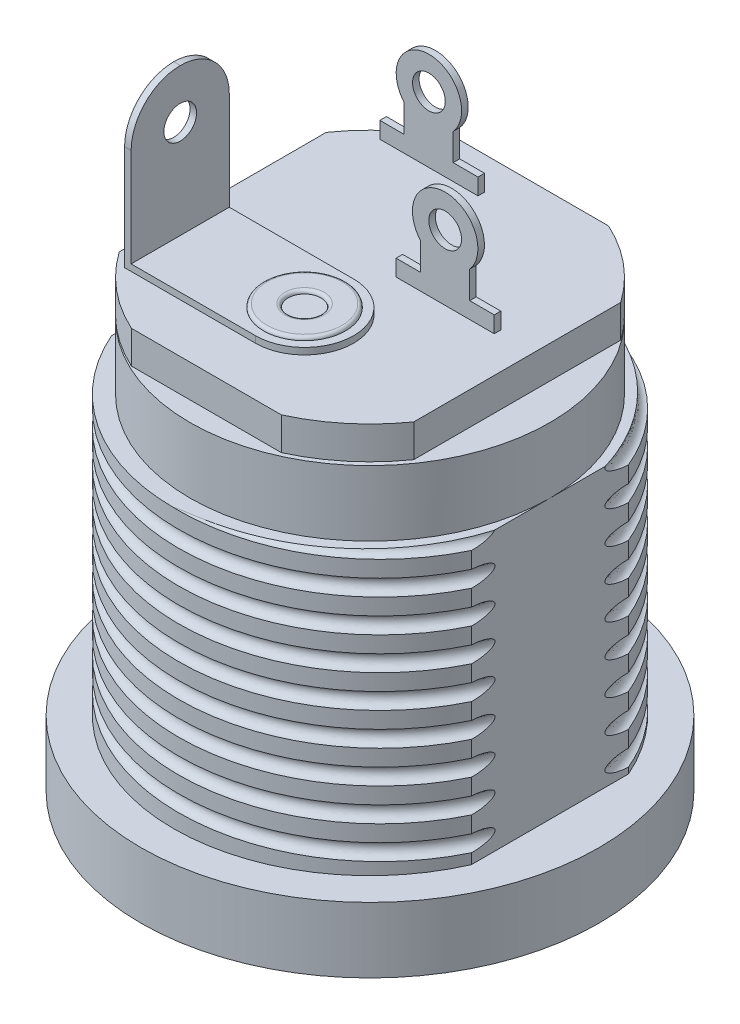
from build123d import *

# Parameters (mm, degrees)
SKETCH1_R            = 7
BOSS_EXTRUDE1_DEPTH  = 2
SKETCH3_R            = 6
BOSS_EXTRUDE2_DEPTH  = 10.5
SKETCH4_OUTSIDE_W    = 20.682
SKETCH4_OUTSIDE_H    = 20.682
SKETCH4_OUTSIDE_W_2  = 11
SKETCH4_OUTSIDE_H_2  = 19.10717674
CUT_EXTRUDE1_DEPTH   = 10.5
CUT_SWEEP1_PITCH     = 1
SKETCH7_OUTSIDE_W    = 20.682
SKETCH7_OUTSIDE_H    = 20.682
SKETCH7_OUTSIDE_R    = 5.5
CUT_EXTRUDE2_DEPTH   = 2
BOSS_EXTRUDE3_START  = 1.1
BOSS_EXTRUDE3_DEPTH  = 1
BOSS_EXTRUDE4_DEPTH  = 0.2
SKETCH12_W           = 0.2
SKETCH12_H           = 3
BOSS_EXTRUDE5_DEPTH  = 4.5
FILLET1_R            = 1.5
SKETCH13_R           = 0.5
CUT_EXTRUDE3_DEPTH   = 23.469757533
SKETCH14_W           = 3
SKETCH14_H           = 0.2
BOSS_EXTRUDE6_DEPTH  = 0.5
SKETCH16_R           = 0.5
BOSS_EXTRUDE7_DEPTH  = 0.2
SKETCH17_W           = 3
SKETCH17_H           = 0.2
BOSS_EXTRUDE8_DEPTH  = 0.5
SKETCH18_R           = 0.5
BOSS_EXTRUDE9_DEPTH  = 0.2
SKETCH21_R           = 3
CUT_EXTRUDE4_DEPTH   = 10
SKETCH22_R           = 1
BOSS_EXTRUDE10_DEPTH = 8
FILLET2_R            = 1
BOSS_EXTRUDE11_DEPTH = 0.1
SKETCH24_R           = 1.25
SKETCH24_R_2         = 0.5
EXTRUDE_THIN1_DEPTH  = 0.1
FILLET3_R            = 0.1


with BuildPart() as part:
    # Sketch1 → Boss-Extrude1 (new body)
    with BuildSketch(Plane(origin=(0, 0, 0), x_dir=(1, 0, 0), z_dir=(0, 1, 0))):
        with Locations(Location((0, 0, 0), (0, 0, 270))):
            Circle(SKETCH1_R)
    extrude(amount=BOSS_EXTRUDE1_DEPTH)

    # Sketch3 → Boss-Extrude2 (add)
    with BuildSketch(Plane(origin=(0, 2, 0), x_dir=(1, 0, 0), z_dir=(0, 1, 0))):
        with Locations(Location((0, 0, 0), (0, 0, 90))):
            Circle(SKETCH3_R)
    extrude(amount=BOSS_EXTRUDE2_DEPTH)

    # Sketch4 outside → Cut-Extrude1 (cut)
    with BuildSketch(Plane(origin=(0, 12.5, 0), x_dir=(1, 0, 0), z_dir=(0, 1, 0))):
        Rectangle(SKETCH4_OUTSIDE_W, SKETCH4_OUTSIDE_H)
        Rectangle(SKETCH4_OUTSIDE_W_2, SKETCH4_OUTSIDE_H_2, mode=Mode.SUBTRACT)
    extrude(amount=-CUT_EXTRUDE1_DEPTH, mode=Mode.SUBTRACT)

    # Cut-Sweep1: arcs per turn and ends read off the stored shape
    # Cut-Sweep1: the profile of Sketch6 screwed along a left-hand helix through 9 turns, 8 arcs to a turn; built about Z, then put on its axis
    cut_sweep1_z = Axis((0, 0, 0), (0, 0, 1))
    cut_sweep1_corners = [(5.75, 0, 0), (6, 0, 0.25), (6.25, 0, 0), (6, 0, -0.25)]
    with BuildLine(mode=Mode.PRIVATE) as cut_sweep1_profile:
        ThreePointArc((5.75, 0, 0), (5.823223305, 0, 0.176776695), (6, 0, 0.25))
        ThreePointArc((6, 0, 0.25), (6.176776695, 0, 0.176776695), (6.25, 0, 0))
        ThreePointArc((6.25, 0, 0), (6.176776695, 0, -0.176776695), (6, 0, -0.25))
        ThreePointArc((6, 0, -0.25), (5.823223305, 0, -0.176776695), (5.75, 0, 0))
    cut_sweep1_cap = Face(cut_sweep1_profile.wire())
    cut_sweep1_arcs = [((5.75, 0, 0), (5.75, 0, 0.25), (6, 0, 0.25), (1, 0.7071067811865476, 1)), ((6, 0, 0.25), (6.25, 0, 0.25), (6.25, 0, 0), (1, 0.7071067811865476, 1)), ((6.25, 0, 0), (6.25, 0, -0.25), (6, 0, -0.25), (1, 0.7071067811865476, 1)), ((6, 0, -0.25), (5.75, 0, -0.25), (5.75, 0, 0), (1, 0.7071067811865476, 1))]  # start, shoulder, end, weights
    cut_sweep1_turn_angles = [0, -22.5, -45, -67.5, -90, -112.5, -135, -157.5, -180, -202.5, -225, -247.5, -270, -292.5, -315, -337.5, -360]
    cut_sweep1_turn_weights = [1, 0.9238795325112867, 1, 0.9238795325112867, 1, 0.9238795325112867, 1, 0.9238795325112867, 1, 0.9238795325112867, 1, 0.9238795325112867, 1, 0.9238795325112867, 1, 0.9238795325112867, 1]
    cut_sweep1_turn_sides = [Face.make_bezier_surface([[Vector(p[j][0], p[j][1], 0).rotate(cut_sweep1_z, cut_sweep1_turn_angles[2 * i + k]) / cut_sweep1_turn_weights[2 * i + k] + Vector(0, 0, p[j][2] + -CUT_SWEEP1_PITCH * cut_sweep1_turn_angles[2 * i + k] / 360) for k in range(3)] for j in range(3)], [[p[3][j] * cut_sweep1_turn_weights[2 * i + k] for k in range(3)] for j in range(3)]) for p in cut_sweep1_arcs for i in range(8)]
    cut_sweep1 = Plane(origin=(0, 2, 0), x_dir=(-1, 0, 0), z_dir=(0, 1, 0)) * Solid(Shell([*[p.moved(Location((0, 0, CUT_SWEEP1_PITCH * i))) for i in range(9) for p in cut_sweep1_turn_sides], cut_sweep1_cap, cut_sweep1_cap.rotate(cut_sweep1_z, -3240).moved(Location((0, 0, -CUT_SWEEP1_PITCH * -3240 / 360)))]))
    add(cut_sweep1, mode=Mode.SUBTRACT)

    # Sketch7 outside → Cut-Extrude2 (cut)
    with BuildSketch(Plane(origin=(0, 12.5, 0), x_dir=(1, 0, 0), z_dir=(0, 1, 0))):
        Rectangle(SKETCH7_OUTSIDE_W, SKETCH7_OUTSIDE_H)
        with Locations(Location((0, 0, 0), (0, 0, 270))):
            Circle(SKETCH7_OUTSIDE_R, mode=Mode.SUBTRACT)
    extrude(amount=-CUT_EXTRUDE2_DEPTH, mode=Mode.SUBTRACT)

    # Sketch21 → Cut-Extrude4 (cut)
    with BuildSketch(Plane.XZ):
        with Locations(Location((0, -2, 0), (0, 0, 270))):
            Circle(SKETCH21_R)
    extrude(amount=-CUT_EXTRUDE4_DEPTH, mode=Mode.SUBTRACT)

    # Sketch22 → Boss-Extrude10 (add)
    with BuildSketch(Plane.XZ.offset(-10)):
        with Locations(Location((0, -2, 0), (0, 0, 270))):
            Circle(SKETCH22_R)
    extrude(amount=BOSS_EXTRUDE10_DEPTH)

    # Fillet2
    fillet2_edges = [part.edges().sort_by_distance(p)[0] for p in [
        (0, 2, -1),
    ]]
    fillet(fillet2_edges, radius=FILLET2_R)

    # Sketch23 → Boss-Extrude11 (add)
    with BuildSketch(Plane.XZ):
        Polygon((-2.287347854, 2.51550619), (-2.00792411, 4.632172857), (-1.980787358, 4.632172857), (-1.106899136, 2.89542072), (-0.235130974, 4.632172857), (-0.20757021, 4.632172857), (0.073549582, 2.51550619), (-0.117255707, 2.51550619), (-0.319933324, 4.038556404), (-1.084002502, 2.51550619), (-1.126827689, 2.51550619), (-1.893864948, 4.041948498), (-2.096118554, 2.51550619), align=None)
        Polygon((0.358485479, 4.632172857), (0.577699555, 4.632172857), (1.131882915, 3.766340859), (1.686066275, 4.632172857), (1.905280351, 4.632172857), (1.241701959, 3.595040111), (1.932417103, 2.51550619), (1.713203027, 2.51550619), (1.131882915, 3.423739363), (0.550562803, 2.51550619), (0.331348727, 2.51550619), (1.022487883, 3.595040111), align=None)
    extrude(amount=BOSS_EXTRUDE11_DEPTH)


with BuildPart() as body_2:
    # Sketch8 → Boss-Extrude3 (new body)
    with BuildSketch(Plane(origin=(0, 12.5, 0), x_dir=(1, 0, 0), z_dir=(0, 1, 0)).offset(BOSS_EXTRUDE3_START)):
        with BuildLine():
            Line((-2.291287847, -5), (2.291287847, -5))
            ThreePointArc((2.291287847, -5), (3.517769678, -4.227918695), (4.5, -3.16227766))
            Line((4.5, -3.16227766), (4.5, 3.16227766))
            ThreePointArc((4.5, 3.16227766), (3.517769678, 4.227918695), (2.291287847, 5))
            Line((2.291287847, 5), (-2.291287847, 5))
            ThreePointArc((-2.291287847, 5), (-3.517769678, 4.227918695), (-4.5, 3.16227766))
            Line((-4.5, 3.16227766), (-4.5, -3.16227766))
            ThreePointArc((-4.5, -3.16227766), (-3.517769678, -4.227918695), (-2.291287847, -5))
        make_face()
    extrude(amount=-BOSS_EXTRUDE3_DEPTH)

    # Sketch10 → Boss-Extrude4 (add)
    with BuildSketch(Plane(origin=(0, 13.6, 0), x_dir=(1, 0, 0), z_dir=(0, 1, 0))):
        with BuildLine():
            Line((0, -0.5), (-4, -0.5))
            Line((-4, -0.5), (-4, -3.5))
            Line((-4, -3.5), (0, -3.5))
            ThreePointArc((0, -3.5), (1.5, -2), (0, -0.5))
        make_face()
    extrude(amount=BOSS_EXTRUDE4_DEPTH)

    # Sketch12 → Boss-Extrude5 (add)
    with BuildSketch(Plane(origin=(0, 13.8, 0), x_dir=(1, 0, 0), z_dir=(0, 1, 0))):
        with Locations((-3.9, -2)):
            Rectangle(SKETCH12_W, SKETCH12_H)
    extrude(amount=BOSS_EXTRUDE5_DEPTH)

    # Fillet1
    fillet1_edges = [body_2.edges().sort_by_distance(p)[0] for p in [
        (-3.9, 18.3, 0.5),
        (-3.9, 18.3, 3.5),
    ]]
    fillet(fillet1_edges, radius=FILLET1_R - 0.0001)  # a hair under: the kernel refuses the full size

    # Sketch13 → Cut-Extrude3 (cut, through all)
    with BuildSketch(Plane.ZY.offset(4)):
        with Locations((2, 16.8)):
            Circle(SKETCH13_R)
    extrude(amount=-CUT_EXTRUDE3_DEPTH, mode=Mode.SUBTRACT)

    # Sketch14 → Boss-Extrude6 (add)
    with BuildSketch(Plane(origin=(0, 13.6, 0), x_dir=(-1, 0, 0), z_dir=(0, 1, 0))):
        with Locations((2, -3.9)):
            Rectangle(SKETCH14_W, SKETCH14_H)
    extrude(amount=BOSS_EXTRUDE6_DEPTH)

    # Sketch16 → Boss-Extrude7 (add)
    with BuildSketch(Plane.XY.offset(-3.8)):
        with BuildLine():
            Line((-2.759197641, 14.1), (-1.259197641, 14.1))
            Line((-1.259197641, 14.1), (-1.259197641, 14.928373654))
            ThreePointArc((-1.259197641, 14.928373654), (-1.986092744, 16.6), (-2.759197641, 14.949236555))
            Line((-2.759197641, 14.949236555), (-2.759197641, 14.1))
        make_face()
        with Locations((-2, 15.600096711)):
            Circle(SKETCH16_R, mode=Mode.SUBTRACT)
    extrude(amount=-BOSS_EXTRUDE7_DEPTH)

    # Sketch17 → Boss-Extrude8 (add)
    with BuildSketch(Plane(origin=(0, 13.6, 0), x_dir=(1, 0, 0), z_dir=(0, 1, 0))):
        with Locations((1.896986969, 0.5)):
            Rectangle(SKETCH17_W, SKETCH17_H)
    extrude(amount=BOSS_EXTRUDE8_DEPTH)

    # Sketch18 → Boss-Extrude9 (add)
    with BuildSketch(Plane.XY.offset(-0.4)):
        with BuildLine():
            Line((1.146986969, 14.1), (2.646986969, 14.1))
            Line((2.646986969, 14.1), (2.646986969, 14.938562172))
            ThreePointArc((2.646986969, 14.938562172), (1.896986969, 16.6), (1.146986969, 14.938562172))
            Line((1.146986969, 14.938562172), (1.146986969, 14.1))
        make_face()
        with Locations((1.896986969, 15.6)):
            Circle(SKETCH18_R, mode=Mode.SUBTRACT)
    extrude(amount=-BOSS_EXTRUDE9_DEPTH)

    # Sketch24 → Extrude-Thin1 (add)
    with BuildSketch(Plane(origin=(0, 13.8, 0), x_dir=(1, 0, 0), z_dir=(0, 1, 0))):
        with Locations((0, -2)):
            Circle(SKETCH24_R)
        with Locations((0, -2)):
            Circle(SKETCH24_R_2, mode=Mode.SUBTRACT)
    extrude(amount=EXTRUDE_THIN1_DEPTH)

    # Fillet3
    fillet3_edges = [body_2.edges().sort_by_distance(p)[0] for p in [
        (-1.25, 13.9, 2),
        (-0.5, 13.9, 2),
    ]]
    fillet(fillet3_edges, radius=FILLET3_R - 0.0001)  # a hair under: the kernel refuses the full size


solid = Compound([part.part, body_2.part])
